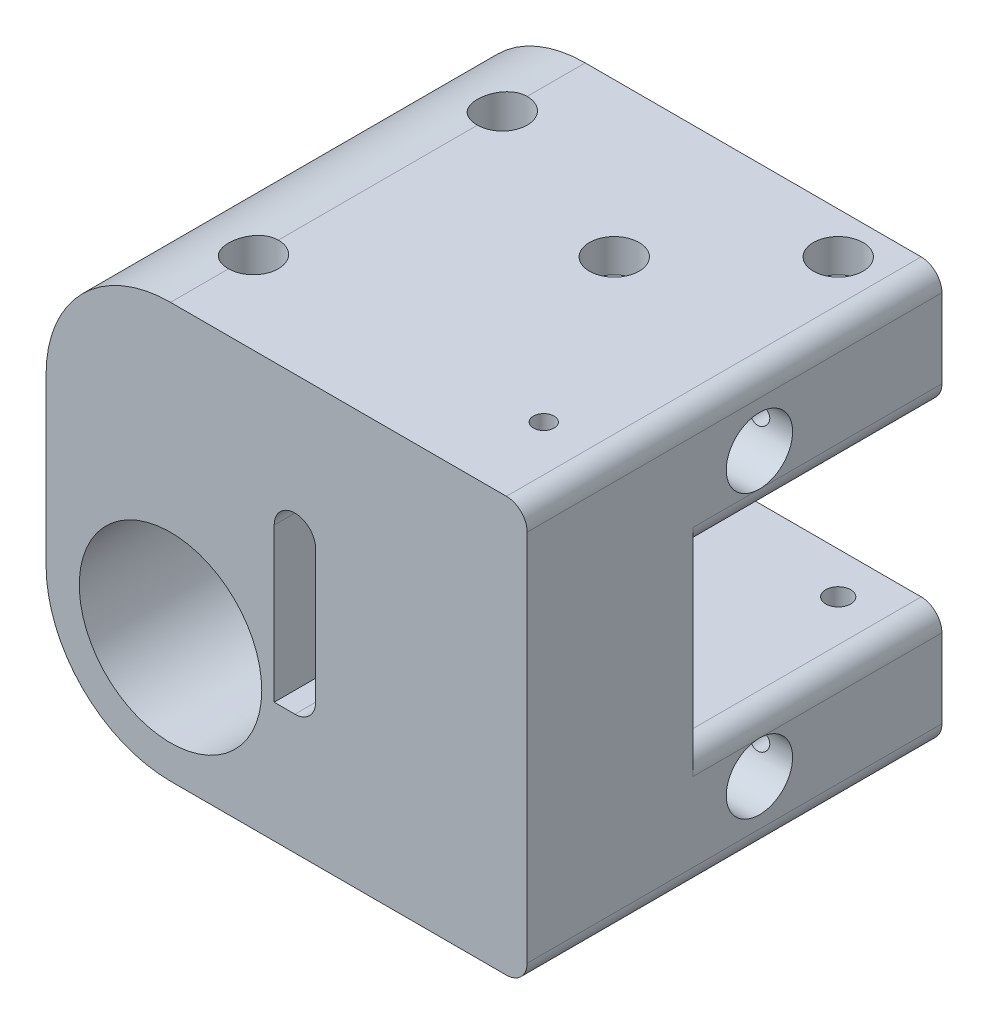
from build123d import *

# Parameters (mm, degrees)
SKETCH1_W                = 58
SKETCH1_H                = 50
SKETCH1_R                = 11
BOSS_EXTRUDE1_DEPTH      = 50
SKETCH2_R                = 4
CUT_EXTRUDE1_DEPTH       = 20
SKETCH3_W                = 5
SKETCH3_H                = 21
CUT_EXTRUDE2_DEPTH       = 92.454906921
SKETCH14_W               = 25.5
SKETCH14_H               = 21
CUT_EXTRUDE9_DEPTH       = 30
SKETCH16_R               = 1.5
CUT_EXTRUDE10_DEPTH      = 57
CUT_EXTRUDE11_DEPTH      = 3
FILLET3_R                = 15
CUT_EXTRUDE12_REACH      = 93.455
SKETCH18_R               = 1.25
CUT_EXTRUDE13_REACH      = 93.455
CUT_EXTRUDE13_END_RADIUS = 11
SKETCH19_R               = 1.25
SKETCH20_R               = 3
CUT_EXTRUDE14_DEPTH      = 10
SKETCH21_R               = 3
CUT_EXTRUDE15_DEPTH      = 3
FILLET4_R                = 2.5
SKETCH22_R               = 1.25
CUT_EXTRUDE16_DEPTH      = 81.274529133
SKETCH23_R               = 3
CUT_EXTRUDE17_DEPTH      = 10
SKETCH24_R               = 3
CUT_EXTRUDE18_DEPTH      = 4
SKETCH25_R               = 1.25
CUT_EXTRUDE19_DEPTH      = 10
SKETCH26_R               = 3
SKETCH26_R_2             = 1.5
BOSS_EXTRUDE2_DEPTH      = 1
BOSS_EXTRUDE3_START      = 1
SKETCH27_R               = 3
SKETCH27_R_2             = 1.5
BOSS_EXTRUDE3_DEPTH      = 1
CHAMFER1_SIZE            = 1
SKETCH28_R               = 1.25
CUT_EXTRUDE20_DEPTH      = 10
CHAMFER2_SIZE            = 1.5


with BuildPart() as part:
    # Sketch1 → Boss-Extrude1 (new body)
    with BuildSketch(Plane.XY):
        with Locations((29, 25)):
            Rectangle(SKETCH1_W, SKETCH1_H)
        with Locations((15, 15)):
            Circle(SKETCH1_R, mode=Mode.SUBTRACT)
    extrude(amount=BOSS_EXTRUDE1_DEPTH)

    # Sketch2 → Cut-Extrude1 (cut)
    with BuildSketch(Plane.ZY.offset(-58)):
        with Locations((22, 42)):
            Circle(SKETCH2_R)
        with Locations((22, 8)):
            Circle(SKETCH2_R)
    extrude(amount=CUT_EXTRUDE1_DEPTH, mode=Mode.SUBTRACT)

    # Sketch3 → Cut-Extrude2 (cut, through all)
    with BuildSketch(Plane(origin=(0, 0, 0), x_dir=(-1, 0, 0), z_dir=(0, 0, -1))):
        with Locations((-30, 25)):
            Rectangle(SKETCH3_W, SKETCH3_H)
    extrude(amount=-CUT_EXTRUDE2_DEPTH, mode=Mode.SUBTRACT)

    # Sketch14 → Cut-Extrude9 (cut)
    with BuildSketch(Plane(origin=(0, 0, 0), x_dir=(-1, 0, 0), z_dir=(0, 0, -1))):
        with Locations((-45.25, 25)):
            Rectangle(SKETCH14_W, SKETCH14_H)
    extrude(amount=-CUT_EXTRUDE9_DEPTH, mode=Mode.SUBTRACT)

    # Sketch16 → Cut-Extrude10 (cut)
    with BuildSketch(Plane(origin=(0, 50, 0), x_dir=(1, 0, 0), z_dir=(0, 1, 0))):
        with Locations(Location((50.5, -5, 0), (0, 0, 270))):
            Circle(SKETCH16_R)
        with Locations(Location((37, -18.5, 0), (0, 0, 270))):
            Circle(SKETCH16_R)
    extrude(amount=-CUT_EXTRUDE10_DEPTH, mode=Mode.SUBTRACT)

    # Sketch17 → Cut-Extrude11 (cut)
    with BuildSketch(Plane.XZ):
        Polygon((38.616580754, 15.7), (40.233161507, 18.5), (38.616580754, 21.3), (35.383419246, 21.3), (33.766838493, 18.5), (35.383419246, 15.7), align=None)
        Polygon((53.733161507, 5), (52.116580754, 7.8), (48.883419246, 7.8), (47.266838493, 5), (48.883419246, 2.2), (52.116580754, 2.2), align=None)
    extrude(amount=-CUT_EXTRUDE11_DEPTH, mode=Mode.SUBTRACT)

    # Fillet3
    fillet3_edges = [part.edges().sort_by_distance(p)[0] for p in [
        (0, 50, 25),
        (0, 0, 25),
    ]]
    fillet(fillet3_edges, radius=FILLET3_R)

    # Sketch18 → Cut-Extrude12 (cut, up to next)
    with BuildSketch(Plane(origin=(0, 0, 0), x_dir=(-1, 0, 0), z_dir=(0, 0, -1)), mode=Mode.PRIVATE) as cut_extrude12_sk1:
        with Locations((-54, 42)):
            Circle(SKETCH18_R)
    cut_extrude12_tool1 = extrude(cut_extrude12_sk1.sketch, amount=-CUT_EXTRUDE12_REACH, mode=Mode.PRIVATE) & part.part
    # Sketch18 → Cut-Extrude12 (cut, up to next)
    with BuildSketch(Plane(origin=(0, 0, 0), x_dir=(-1, 0, 0), z_dir=(0, 0, -1)), mode=Mode.PRIVATE) as cut_extrude12_sk2:
        with Locations((-54, 8)):
            Circle(SKETCH18_R)
    cut_extrude12_tool2 = extrude(cut_extrude12_sk2.sketch, amount=-CUT_EXTRUDE12_REACH, mode=Mode.PRIVATE) & part.part
    add(cut_extrude12_tool1.solids().sort_by_distance((54, 42, 0))[0], mode=Mode.SUBTRACT)
    add(cut_extrude12_tool2.solids().sort_by_distance((54, 8, 0))[0], mode=Mode.SUBTRACT)

    # Cut-Extrude13: up to this cylinder (the profile starts outside it)
    cut_extrude13_end = Plane(origin=(15, 15, 25), z_dir=(0, 0, -1)) * Cylinder(CUT_EXTRUDE13_END_RADIUS, 239.91, mode=Mode.PRIVATE)
    # Sketch19 → Cut-Extrude13 (cut, up to the surface)
    with BuildSketch(Plane(origin=(0, 50, 0), x_dir=(1, 0, 0), z_dir=(0, 1, 0)), mode=Mode.PRIVATE) as cut_extrude13_sk1:
        with Locations(Location((15, -10, 0), (0, 0, 270))):
            Circle(SKETCH19_R)
    cut_extrude13_tool1 = extrude(cut_extrude13_sk1.sketch, amount=-CUT_EXTRUDE13_REACH, mode=Mode.PRIVATE) - cut_extrude13_end
    add(cut_extrude13_tool1.solids().sort_by_distance((15, 50, 10))[0], mode=Mode.SUBTRACT)
    # Sketch19 → Cut-Extrude13 (cut, up to the surface)
    with BuildSketch(Plane(origin=(0, 50, 0), x_dir=(1, 0, 0), z_dir=(0, 1, 0)), mode=Mode.PRIVATE) as cut_extrude13_sk2:
        with Locations(Location((15, -40, 0), (0, 0, 270))):
            Circle(SKETCH19_R)
    cut_extrude13_tool2 = extrude(cut_extrude13_sk2.sketch, amount=-CUT_EXTRUDE13_REACH, mode=Mode.PRIVATE) - cut_extrude13_end
    add(cut_extrude13_tool2.solids().sort_by_distance((15, 50, 40))[0], mode=Mode.SUBTRACT)

    # Sketch20 → Cut-Extrude14 (cut)
    with BuildSketch(Plane(origin=(0, 50, 0), x_dir=(1, 0, 0), z_dir=(0, 1, 0))):
        with Locations(Location((15, -10, 0), (0, 0, 270))):
            Circle(SKETCH20_R)
        with Locations(Location((15, -40, 0), (0, 0, 270))):
            Circle(SKETCH20_R)
    extrude(amount=-CUT_EXTRUDE14_DEPTH, mode=Mode.SUBTRACT)

    # Sketch21 → Cut-Extrude15 (cut)
    with BuildSketch(Plane(origin=(0, 0, 0), x_dir=(-1, 0, 0), z_dir=(0, 0, -1))):
        with Locations((-54, 42)):
            Circle(SKETCH21_R)
        with Locations((-54, 8)):
            Circle(SKETCH21_R)
    extrude(amount=-CUT_EXTRUDE15_DEPTH, mode=Mode.SUBTRACT)

    # Fillet4
    fillet4_edges = [part.edges().sort_by_distance(p)[0] for p in [
        (32.5, 35.5, 40),
        (32.5, 14.5, 40),
        (58, 0, 25),
        (58, 14.5, 15),
        (27.5, 35.5, 25),
        (58, 35.5, 15),
        (58, 50, 25),
    ]]
    fillet(fillet4_edges, radius=FILLET4_R - 0.0001)  # a hair under: the kernel refuses the full size

    # Sketch22 → Cut-Extrude16 (cut, through all)
    with BuildSketch(Plane(origin=(38, 0, 0), x_dir=(0, 0, -1), z_dir=(1, 0, 0))):
        with Locations((-22, 42)):
            Circle(SKETCH22_R)
    extrude(amount=-CUT_EXTRUDE16_DEPTH, mode=Mode.SUBTRACT)

    # Sketch23 → Cut-Extrude17 (cut)
    with BuildSketch(Plane.ZY):
        with Locations((22, 42)):
            Circle(SKETCH23_R)
    extrude(amount=-CUT_EXTRUDE17_DEPTH, mode=Mode.SUBTRACT)

    # Sketch24 → Cut-Extrude18 (cut)
    with BuildSketch(Plane(origin=(0, 50, 0), x_dir=(1, 0, 0), z_dir=(0, 1, 0))):
        with Locations(Location((50.5, -5, 0), (0, 0, 270))):
            Circle(SKETCH24_R)
        with Locations(Location((37, -18.5, 0), (0, 0, 270))):
            Circle(SKETCH24_R)
    extrude(amount=-CUT_EXTRUDE18_DEPTH, mode=Mode.SUBTRACT)

    # Sketch25 → Cut-Extrude19 (cut)
    with BuildSketch(Plane(origin=(0, 50, 0), x_dir=(1, 0, 0), z_dir=(0, 1, 0))):
        with Locations(Location((50, -40, 0), (0, 0, 270))):
            Circle(SKETCH25_R)
    extrude(amount=-CUT_EXTRUDE19_DEPTH, mode=Mode.SUBTRACT)

    # Sketch26 → Boss-Extrude2 (add)
    with BuildSketch(Plane.XZ.offset(-35.5)):
        with Locations(Location((50.5, 5, 0), (0, 0, 90))):
            Circle(SKETCH26_R)
        with Locations(Location((50.5, 5, 0), (0, 0, 90))):
            Circle(SKETCH26_R_2, mode=Mode.SUBTRACT)
    extrude(amount=BOSS_EXTRUDE2_DEPTH)

    # Sketch27 → Boss-Extrude3 (add)
    with BuildSketch(Plane(origin=(0, 14.5, 0), x_dir=(1, 0, 0), z_dir=(0, 1, 0)).offset(BOSS_EXTRUDE3_START)):
        with Locations(Location((37, -18.5, 0), (0, 0, 270))):
            Circle(SKETCH27_R)
        with Locations(Location((37, -18.5, 0), (0, 0, 270))):
            Circle(SKETCH27_R_2, mode=Mode.SUBTRACT)
    extrude(amount=-BOSS_EXTRUDE3_DEPTH)

    # Chamfer1
    chamfer1_edges = [part.edges().sort_by_distance(p)[0] for p in [
        (50.5, 34.5, 2),
        (37, 15.5, 15.5),
    ]]
    chamfer(chamfer1_edges, length=CHAMFER1_SIZE - 0.0001)  # a hair under: the kernel refuses the full size

    # Sketch28 → Cut-Extrude20 (cut)
    with BuildSketch(Plane(origin=(0, 0, 0), x_dir=(-1, 0, 0), z_dir=(0, 0, -1))):
        with Locations((-20.088889062, 34.9)):
            Circle(SKETCH28_R)
    extrude(amount=-CUT_EXTRUDE20_DEPTH, mode=Mode.SUBTRACT)

    # Chamfer2
    chamfer2_edges = [part.edges().sort_by_distance(p)[0] for p in [
        (21.338889062, 34.9, 0),
    ]]
    chamfer(chamfer2_edges, length=CHAMFER2_SIZE)


solid = part.part
